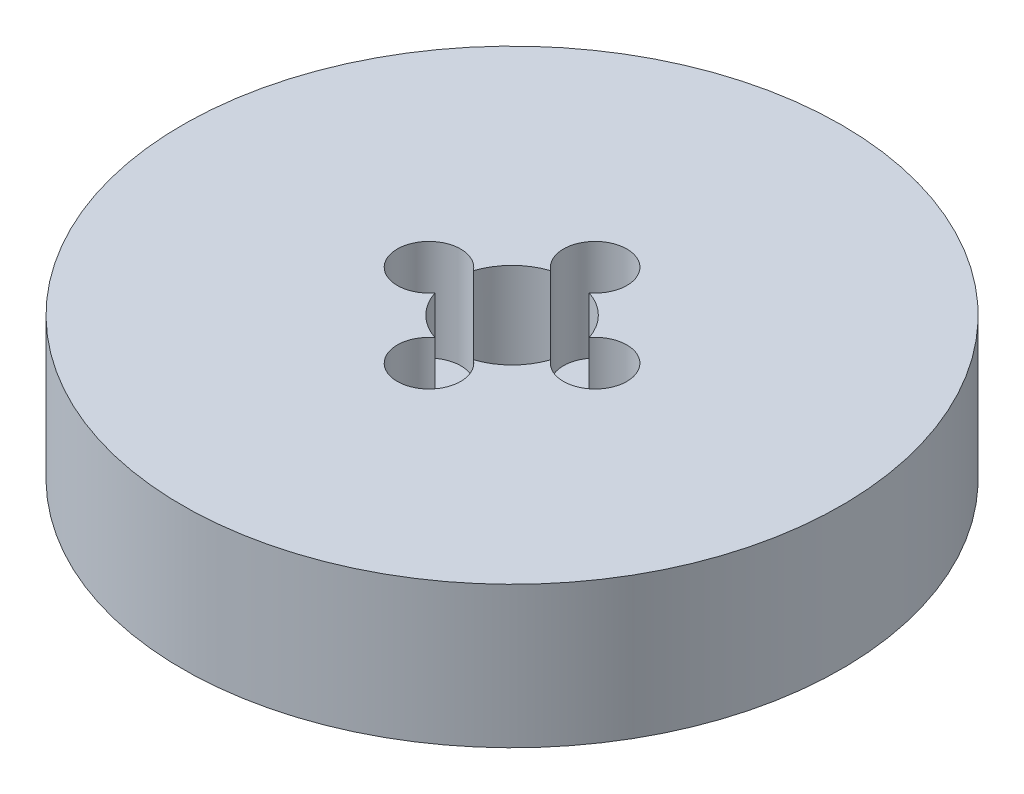
from build123d import *

# Parameters (mm, degrees)
SKETCH1_R           = 67.5
BOSS_EXTRUDE1_DEPTH = 29
SKETCH2_R           = 12.5
CUT_EXTRUDE1_DEPTH  = 100.767229089
SKETCH3_R           = 6.488909409
CUT_EXTRUDE2_DEPTH  = 20.706972399
CIRPATTERN1_COUNT   = 4


with BuildPart() as part:
    # Sketch1 → Boss-Extrude1 (new body)
    with BuildSketch(Plane(origin=(0, 0, 0), x_dir=(1, 0, 0), z_dir=(0, 1, 0))):
        Circle(SKETCH1_R)
    extrude(amount=BOSS_EXTRUDE1_DEPTH)

    # Sketch2 → Cut-Extrude1 (cut, through all)
    with BuildSketch(Plane(origin=(0, 0, 0), x_dir=(1, 0, 0), z_dir=(0, 1, 0))):
        Circle(SKETCH2_R)
    extrude(amount=CUT_EXTRUDE1_DEPTH, mode=Mode.SUBTRACT)

    # Sketch3 → Cut-Extrude2 (cut)
    with BuildSketch(Plane(origin=(0, 29, 0), x_dir=(1, 0, 0), z_dir=(0, 1, 0))):
        with Locations((-17.017535659, 0)):
            Circle(SKETCH3_R)
    cut_extrude2 = extrude(amount=-CUT_EXTRUDE2_DEPTH, mode=Mode.SUBTRACT)

    # CirPattern1: Cut-Extrude2 ×4 about axis
    cirpattern1_axis = Axis((0, 0, 0), (0, 1, 0))
    for i in range(1, CIRPATTERN1_COUNT):
        add(cut_extrude2.rotate(cirpattern1_axis, i * 360 / CIRPATTERN1_COUNT), mode=Mode.SUBTRACT)


solid = part.part
